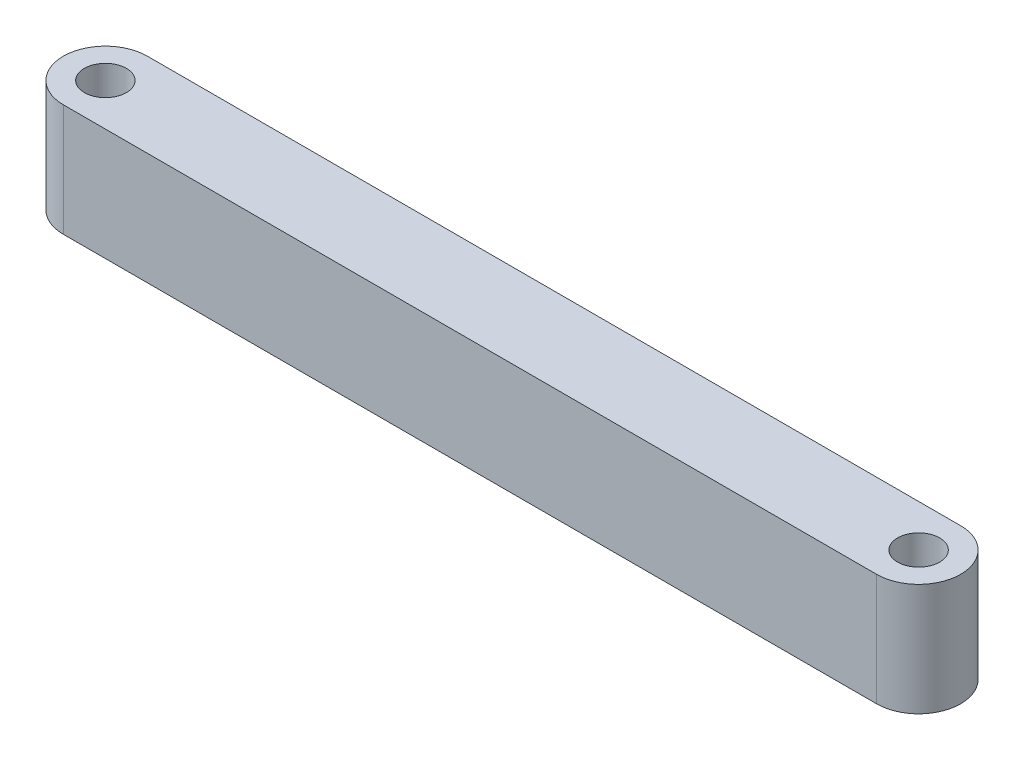
from build123d import *

# Parameters (mm, degrees)
CROQUIS1_R              = 0.75
SALIENTE_EXTRUIR1_DEPTH = 4


with BuildPart() as part:
    # Croquis1 → Saliente-Extruir1 (new body)
    with BuildSketch(Plane(origin=(0, 0, 0), x_dir=(1, 0, 0), z_dir=(0, 1, 0))):
        with BuildLine():
            Line((-14.5, 1.5), (14.5, 1.5))
            ThreePointArc((14.5, 1.5), (16, 0), (14.5, -1.5))
            Line((14.5, -1.5), (-14.5, -1.5))
            ThreePointArc((-14.5, -1.5), (-16, 0), (-14.5, 1.5))
        make_face()
        with Locations((14.5, 0)):
            Circle(CROQUIS1_R, mode=Mode.SUBTRACT)
        with Locations((-14.5, 0)):
            Circle(CROQUIS1_R, mode=Mode.SUBTRACT)
    extrude(amount=SALIENTE_EXTRUIR1_DEPTH)


solid = part.part
